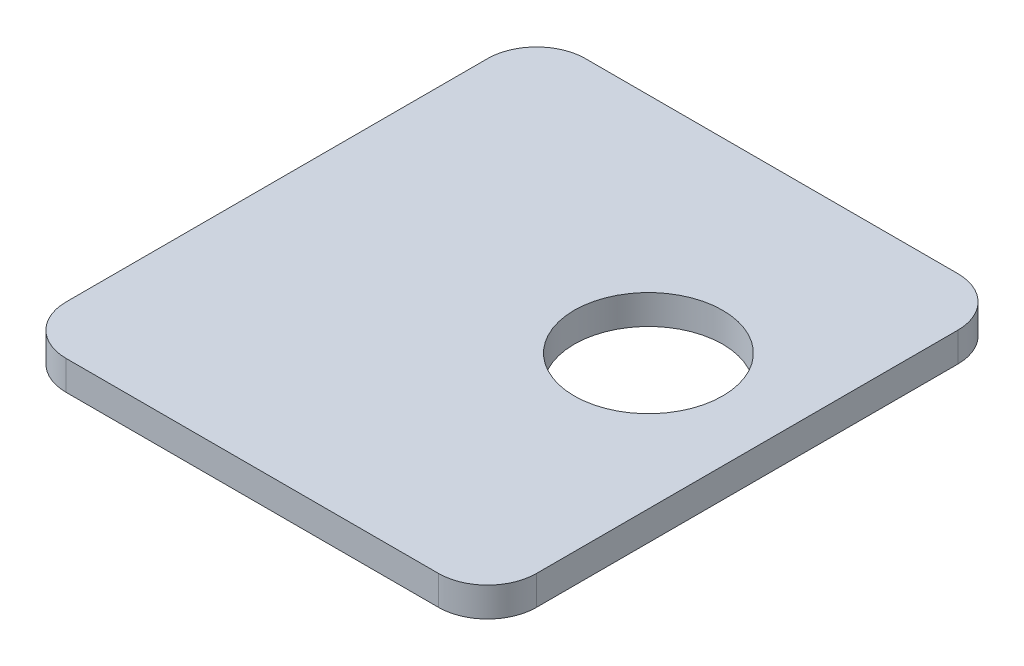
from build123d import *

# Parameters (mm, degrees)
SKETCH1_R           = 7.575
BOSS_EXTRUDE1_DEPTH = 3


with BuildPart() as part:
    # Sketch1 → Boss-Extrude1 (new body)
    with BuildSketch(Plane(origin=(0, 0, 0), x_dir=(1, 0, 0), z_dir=(0, 1, 0))):
        with BuildLine():
            Line((-19.42229117, 32.206654834), (18.57770883, 32.206654834))
            ThreePointArc((18.57770883, 32.206654834), (22.113242736, 30.74218874), (23.57770883, 27.206654834))
            Line((23.57770883, 27.206654834), (23.57770883, -15.793345166))
            ThreePointArc((23.57770883, -15.793345166), (22.113242736, -19.328879072), (18.57770883, -20.793345166))
            Line((18.57770883, -20.793345166), (-19.42229117, -20.793345166))
            ThreePointArc((-19.42229117, -20.793345166), (-22.957825076, -19.328879072), (-24.42229117, -15.793345166))
            Line((-24.42229117, -15.793345166), (-24.42229117, 27.206654834))
            ThreePointArc((-24.42229117, 27.206654834), (-22.957825076, 30.74218874), (-19.42229117, 32.206654834))
        make_face()
        with Locations((9.818366769, 9.392128974)):
            Circle(SKETCH1_R, mode=Mode.SUBTRACT)
    extrude(amount=BOSS_EXTRUDE1_DEPTH)


solid = part.part
